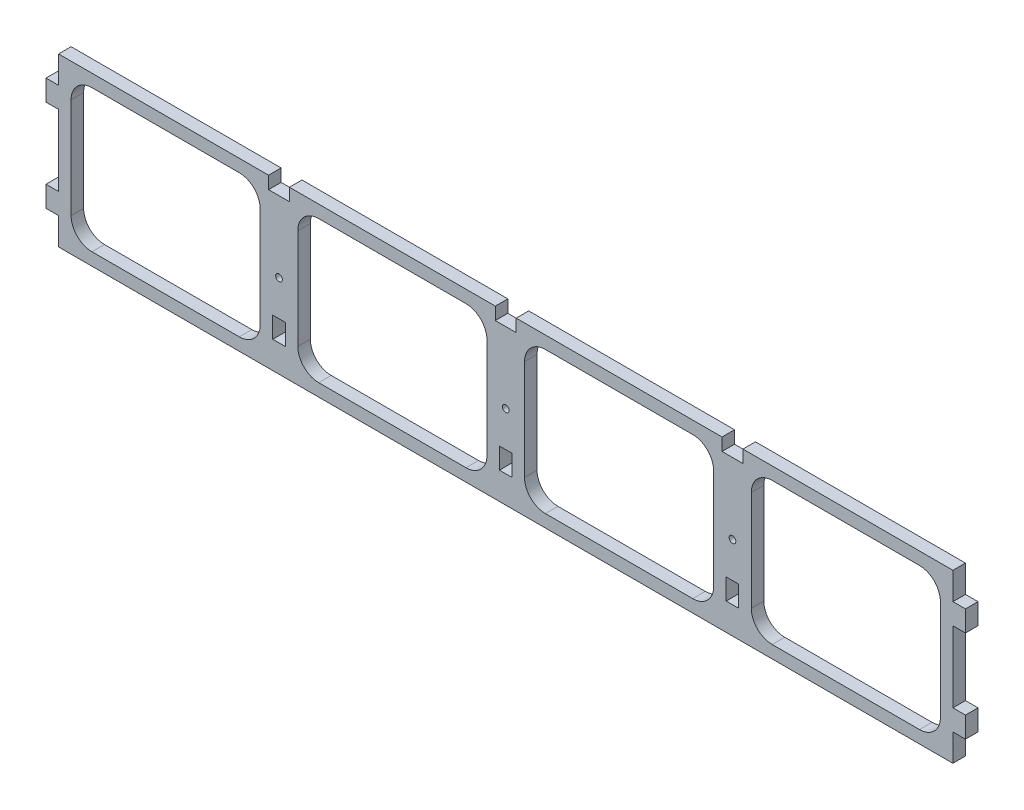
from build123d import *

# Parameters (mm, degrees)
SKETCH1_W           = 428
SKETCH1_H           = 80
BOSS_EXTRUDE1_DEPTH = 6
CUT_EXTRUDE1_REACH  = 219.789
LPATTERN1_COUNT     = 4
LPATTERN1_PITCH     = 108.5
SKETCH3_R           = 1.6
SKETCH3_W           = 6
SKETCH3_H           = 10
CUT_EXTRUDE2_DEPTH  = 218.788888605
SKETCH4_W           = 6
SKETCH4_H           = 10
BOSS_EXTRUDE2_DEPTH = 6
SKETCH5_W           = 10
SKETCH5_H           = 6
CUT_EXTRUDE3_DEPTH  = 6


with BuildPart() as part:
    # Sketch1 → Boss-Extrude1 (new body)
    with BuildSketch(Plane.XY):
        Rectangle(SKETCH1_W, SKETCH1_H)
    extrude(amount=BOSS_EXTRUDE1_DEPTH)

    # Sketch2 → Cut-Extrude1 (cut, up to next)
    with BuildSketch(Plane.XY.offset(6), mode=Mode.PRIVATE) as cut_extrude1_sk1:
        with BuildLine():
            ThreePointArc((-127.5, -34), (-120.428932188, -31.071067812), (-117.5, -24))
            Line((-117.5, -24), (-117.5, 24))
            ThreePointArc((-117.5, 24), (-120.428932188, 31.071067812), (-127.5, 34))
            Line((-127.5, 34), (-198, 34))
            ThreePointArc((-198, 34), (-205.071067812, 31.071067812), (-208, 24))
            Line((-208, 24), (-208, -24))
            ThreePointArc((-208, -24), (-205.071067812, -31.071067812), (-198, -34))
            Line((-198, -34), (-127.5, -34))
        make_face()
    cut_extrude1_tool1 = extrude(cut_extrude1_sk1.sketch, amount=-CUT_EXTRUDE1_REACH, mode=Mode.PRIVATE) & part.part
    cut_extrude1 = cut_extrude1_tool1.solids().sort_by_distance((-162.75, 0, 6))[0]
    add(cut_extrude1, mode=Mode.SUBTRACT)

    # LPattern1: Cut-Extrude1 ×4
    with Locations(*[(i * LPATTERN1_PITCH, 0, 0) for i in range(1, LPATTERN1_COUNT)]):
        add(cut_extrude1, mode=Mode.SUBTRACT)

    # Sketch3 → Cut-Extrude2 (cut, through all)
    with BuildSketch(Plane(origin=(0, 0, 0), x_dir=(-1, 0, 0), z_dir=(0, 0, -1))):
        with Locations((108.5, 0)):
            Circle(SKETCH3_R)
        Circle(SKETCH3_R)
        with Locations((-108.5, 0)):
            Circle(SKETCH3_R)
        with Locations((-108.5, -22)):
            Rectangle(SKETCH3_W, SKETCH3_H)
        with Locations((0, -22)):
            Rectangle(SKETCH3_W, SKETCH3_H)
        with Locations((108.5, -22)):
            Rectangle(SKETCH3_W, SKETCH3_H)
    extrude(amount=-CUT_EXTRUDE2_DEPTH, mode=Mode.SUBTRACT)

    # Sketch4 → Boss-Extrude2 (add)
    with BuildSketch(Plane(origin=(0, 0, 0), x_dir=(-1, 0, 0), z_dir=(0, 0, -1))):
        with Locations((-217, 22)):
            Rectangle(SKETCH4_W, SKETCH4_H)
        with Locations((-217, -22)):
            Rectangle(SKETCH4_W, SKETCH4_H)
        with Locations((217, -22)):
            Rectangle(SKETCH4_W, SKETCH4_H)
        with Locations((217, 22)):
            Rectangle(SKETCH4_W, SKETCH4_H)
    extrude(amount=-BOSS_EXTRUDE2_DEPTH)

    # Sketch5 → Cut-Extrude3 (cut)
    with BuildSketch(Plane(origin=(0, 40, 0), x_dir=(1, 0, 0), z_dir=(0, 1, 0))):
        with Locations((-108.5, -3)):
            Rectangle(SKETCH5_W, SKETCH5_H)
        with Locations((0, -3)):
            Rectangle(SKETCH5_W, SKETCH5_H)
        with Locations((108.5, -3)):
            Rectangle(SKETCH5_W, SKETCH5_H)
    extrude(amount=-CUT_EXTRUDE3_DEPTH, mode=Mode.SUBTRACT)


solid = part.part
